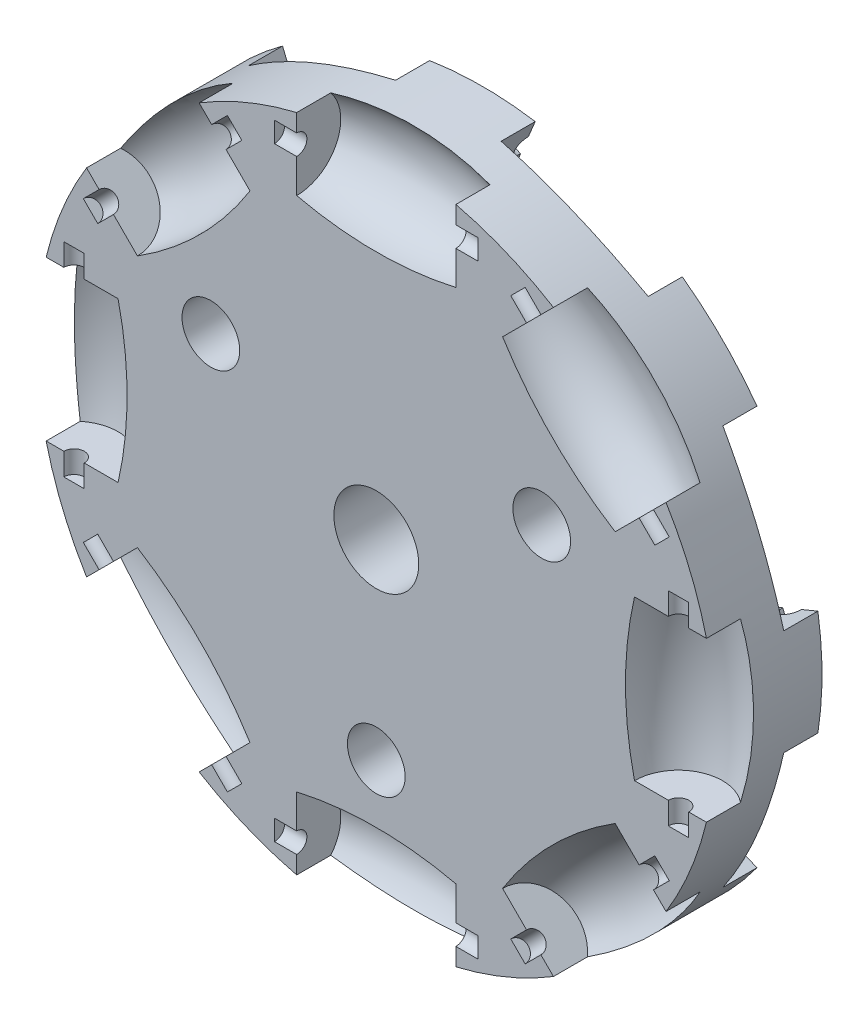
from build123d import *

# Parameters (mm, degrees)
SKETCH1_R           = 25.4
BOSS_EXTRUDE1_DEPTH = 3.96875
SKETCH6_R           = 0.762
CUT_EXTRUDE2_DEPTH  = 7.62
SKETCH10_R          = 0.762
CUT_EXTRUDE3_DEPTH  = 7.62
CIRPATTERN1_COUNT   = 8
SKETCH16_R          = 2.159
CUT_EXTRUDE7_DEPTH  = 37.787551128
SKETCH17_R          = 3.175
CUT_EXTRUDE8_DEPTH  = 37.787551128


with BuildPart() as part:
    # Sketch1 → Boss-Extrude1 (new, symmetric)
    with BuildSketch(Plane.XY):
        Circle(SKETCH1_R)
    extrude(amount=BOSS_EXTRUDE1_DEPTH, both=True)

    # Sketch5 → Cut-Revolve5 (revolve, cut)
    with BuildSketch(Plane.XY.offset(3.96875)):
        with BuildLine():
            Line((-5.953125, 25.899375288), (-5.953125, 22.606))
            Line((-5.953125, 22.606), (5.953125, 22.606))
            Line((5.953125, 22.606), (5.953125, 25.899375288))
            ThreePointArc((5.953125, 25.899375288), (0, 26.57475), (-5.953125, 25.899375288))
        make_face()
    cut_revolve5 = revolve(axis=Axis((-5.953125, 22.606, 3.96875), (1, 0, 0)), mode=Mode.SUBTRACT)

    # Sketch8 → Cut-Revolve6 (revolve, cut)
    with BuildSketch(Plane.XY.offset(-3.96875)):
        with BuildLine():
            Line((4.411291489, 26.206065041), (3.15097133, 23.16338302))
            Line((3.15097133, 23.16338302), (14.150912014, 18.607058404))
            Line((14.150912014, 18.607058404), (15.411232173, 21.649740425))
            ThreePointArc((15.411232173, 21.649740425), (10.169716544, 24.551867607), (4.411291489, 26.206065041))
        make_face()
    cut_revolve6 = revolve(axis=Axis((3.15097133, 23.16338302, -3.96875), (-0.9238795325112866, 0.38268343236509017, 0)), mode=Mode.SUBTRACT)

    # Sketch6 → Cut-Extrude2 (cut, symmetric)
    with BuildSketch(Plane(origin=(0, 0, 0), x_dir=(0, 0, -1), z_dir=(1, 0, 0))):
        with Locations((-3.96875, 22.606)):
            Circle(SKETCH6_R)
    cut_extrude2 = extrude(amount=CUT_EXTRUDE2_DEPTH, both=True, mode=Mode.SUBTRACT)

    # Sketch10 → Cut-Extrude3 (cut, symmetric)
    with BuildSketch(Plane(origin=(0, 0, 0), x_dir=(0, 0, -1), z_dir=(0.9238795325112866, -0.38268343236509017, 0))):
        with Locations((3.96875, 22.606)):
            Circle(SKETCH10_R)
    cut_extrude3 = extrude(amount=CUT_EXTRUDE3_DEPTH, both=True, mode=Mode.SUBTRACT)

    # CirPattern1: Cut-Revolve5, Cut-Revolve6, Cut-Extrude2, Cut-Extrude3 ×8 about axis
    cirpattern1_axis = Axis((0, 0, 3.96875), (0, 0, -1))
    add([cut_revolve5.rotate(cirpattern1_axis, i * 360 / CIRPATTERN1_COUNT) for i in range(1, CIRPATTERN1_COUNT)], mode=Mode.SUBTRACT)
    add([cut_revolve6.rotate(cirpattern1_axis, i * 360 / CIRPATTERN1_COUNT) for i in range(1, CIRPATTERN1_COUNT)], mode=Mode.SUBTRACT)
    add([cut_extrude2.rotate(cirpattern1_axis, i * 360 / CIRPATTERN1_COUNT) for i in range(1, CIRPATTERN1_COUNT)], mode=Mode.SUBTRACT)
    add([cut_extrude3.rotate(cirpattern1_axis, i * 360 / CIRPATTERN1_COUNT) for i in range(1, CIRPATTERN1_COUNT)], mode=Mode.SUBTRACT)

    # Sketch16 → Cut-Extrude7 (cut, through all)
    with BuildSketch(Plane.XY.offset(3.96875)):
        with Locations((0, -14.2875)):
            Circle(SKETCH16_R)
        with Locations((-12.373337957, 7.14375)):
            Circle(SKETCH16_R)
        with Locations((12.373337957, 7.14375)):
            Circle(SKETCH16_R)
    extrude(amount=-CUT_EXTRUDE7_DEPTH, mode=Mode.SUBTRACT)

    # Sketch17 → Cut-Extrude8 (cut, through all)
    with BuildSketch(Plane.XY.offset(3.96875)):
        Circle(SKETCH17_R)
    extrude(amount=-CUT_EXTRUDE8_DEPTH, mode=Mode.SUBTRACT)


solid = part.part
